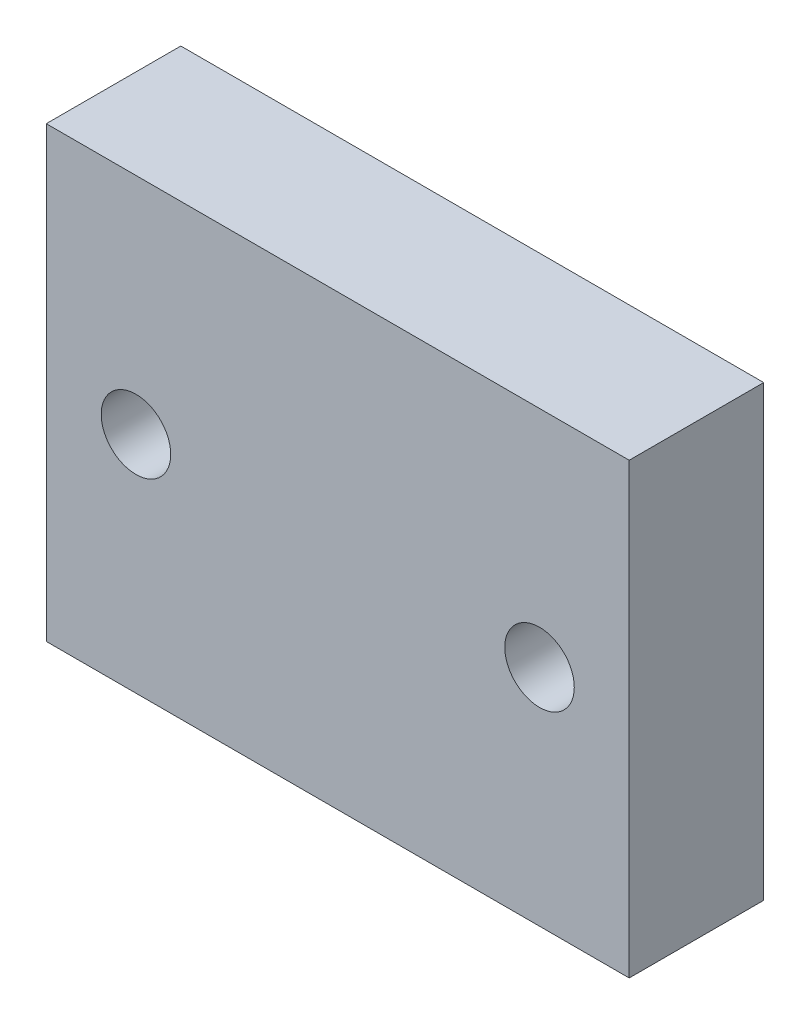
from build123d import *

# Parameters (mm, degrees)
SKETCH1_W           = 26
SKETCH1_H           = 20
SKETCH1_R           = 1.55
BOSS_EXTRUDE1_DEPTH = 6
SKETCH4_W           = 10
SKETCH4_H           = 2
CUT_EXTRUDE3_DEPTH  = 1
CHAMFER1_SIZE       = 1


with BuildPart() as part:
    # Sketch1 → Boss-Extrude1 (new body)
    with BuildSketch(Plane.XY):
        Rectangle(SKETCH1_W, SKETCH1_H)
        with Locations((9, 0)):
            Circle(SKETCH1_R, mode=Mode.SUBTRACT)
        with Locations((-9, 0)):
            Circle(SKETCH1_R, mode=Mode.SUBTRACT)
    extrude(amount=BOSS_EXTRUDE1_DEPTH)

    # Sketch4 → Cut-Extrude3 (cut)
    with BuildSketch(Plane(origin=(0, 0, 0), x_dir=(-1, 0, 0), z_dir=(0, 0, -1))):
        with Locations((0, 3)):
            Rectangle(SKETCH4_W, SKETCH4_H)
    extrude(amount=-CUT_EXTRUDE3_DEPTH, mode=Mode.SUBTRACT)

    # Chamfer1
    chamfer1_edges = [part.edges().sort_by_distance(p)[0] for p in [
        (0, 4, 0),
    ]]
    chamfer(chamfer1_edges, length=CHAMFER1_SIZE - 0.0001)  # a hair under: the kernel refuses the full size


solid = part.part
